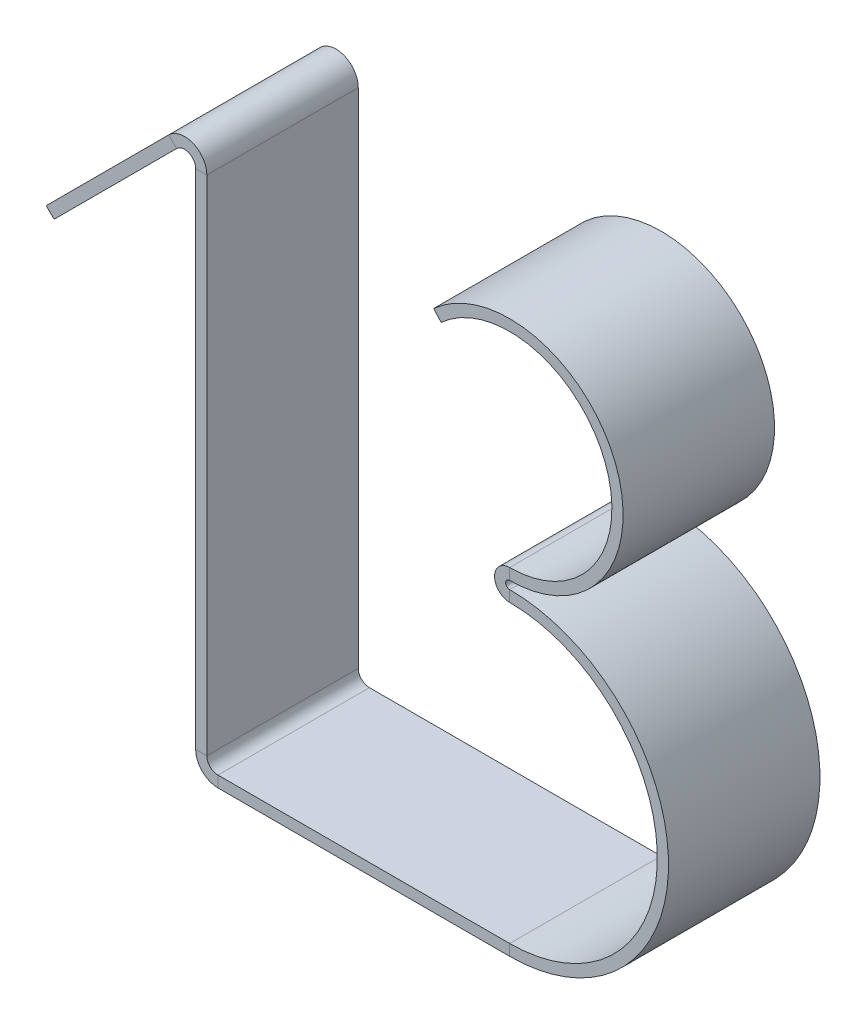
from build123d import *

# Parameters (mm, degrees)
BASE_FLANGE1_DEPTH = 5


# Sheet-metal steps are written as plain solids
with BuildPart() as part:
    # Sketch1 → Base-Flange1 (new, symmetric)
    with BuildSketch(Plane.XY):
        with BuildLine():
            Line((-10.606601718, 26.893398282), (-2.51490971, 34.98509029))
            ThreePointArc((-2.51490971, 34.98509029), (-0.909430767, 35.304439907), (0, 33.94338058))
            Line((0, 33.94338058), (0, 0.7366))
            ThreePointArc((0, 0.7366), (0.215745145, 0.215745145), (0.7366, 0))
            Line((0.7366, 0), (20, 0))
            ThreePointArc((20, 0), (29.75, 9.75), (20, 19.5))
            ThreePointArc((20, 19.5), (19, 20.5), (20, 21.5))
            ThreePointArc((20, 21.5), (26.298801772, 30.676436942), (15.471512501, 33.255527043))
            Line((15.471512501, 33.255527043), (14.97733711, 33.801759816))
            ThreePointArc((14.97733711, 33.801759816), (26.986164348, 30.94122412), (20, 20.7634))
            ThreePointArc((20, 20.7634), (19.7366, 20.5), (20, 20.2366))
            ThreePointArc((20, 20.2366), (30.4866, 9.75), (20, -0.7366))
            Line((20, -0.7366), (0.7366, -0.7366))
            ThreePointArc((0.7366, -0.7366), (-0.30510971, -0.30510971), (-0.7366, 0.7366))
            Line((-0.7366, 0.7366), (-0.7366, 33.94338058))
            ThreePointArc((-0.7366, 33.94338058), (-1.191315384, 34.623910244), (-1.994054855, 34.464235435))
            Line((-1.994054855, 34.464235435), (-10.085746863, 26.372543427))
            Line((-10.085746863, 26.372543427), (-10.606601718, 26.893398282))
        make_face()
    extrude(amount=BASE_FLANGE1_DEPTH, both=True)


solid = part.part
